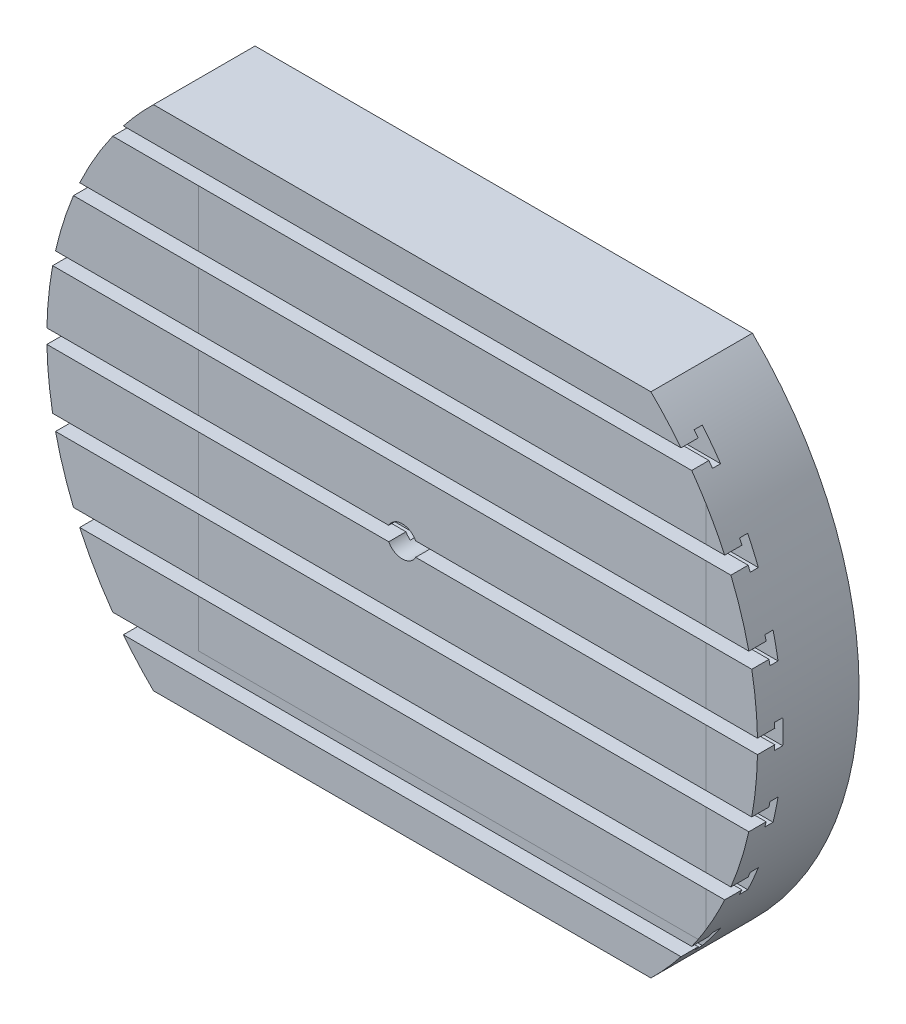
from build123d import *

# Parameters (mm, degrees)
SKETCH1_R           = 350
SKETCH1_R_2         = 15
BOSS_EXTRUDE1_DEPTH = 100
SKETCH2_W           = 100
SKETCH2_H           = 100
CUT_EXTRUDE1_DEPTH  = 500


with BuildPart() as part:
    # Sketch1 → Boss-Extrude1 (new body)
    with BuildSketch(Plane.XY):
        Circle(SKETCH1_R)
        Circle(SKETCH1_R_2, mode=Mode.SUBTRACT)
    extrude(amount=BOSS_EXTRUDE1_DEPTH)

    # Sketch2 → Cut-Extrude1 (cut, symmetric)
    with BuildSketch(Plane(origin=(0, 0, 0), x_dir=(0, 0, -1), z_dir=(1, 0, 0))):
        Polygon((-100, 7), (-83, 7), (-83, 12), (-75, 12), (-75, -12), (-83, -12), (-83, -7), (-100, -7), align=None)
        Polygon((-100, -77), (-100, -63), (-83, -63), (-83, -58), (-75, -58), (-75, -82), (-83, -82), (-83, -77), align=None)
        Polygon((-100, -147), (-100, -133), (-83, -133), (-83, -128), (-75, -128), (-75, -152), (-83, -152), (-83, -147), align=None)
        Polygon((-100, -217), (-100, -203), (-83, -203), (-83, -198), (-75, -198), (-75, -222), (-83, -222), (-83, -217), align=None)
        with Locations((-50, -300)):
            Rectangle(SKETCH2_W, SKETCH2_H)
        Polygon((-100, 63), (-100, 77), (-83, 77), (-83, 82), (-75, 82), (-75, 58), (-83, 58), (-83, 63), align=None)
        with Locations((-50, 300)):
            Rectangle(SKETCH2_W, SKETCH2_H)
        Polygon((-100, 133), (-100, 147), (-83, 147), (-83, 152), (-75, 152), (-75, 128), (-83, 128), (-83, 133), align=None)
        Polygon((-100, 203), (-100, 217), (-83, 217), (-83, 222), (-75, 222), (-75, 198), (-83, 198), (-83, 203), align=None)
    extrude(amount=CUT_EXTRUDE1_DEPTH, both=True, mode=Mode.SUBTRACT)


solid = part.part
